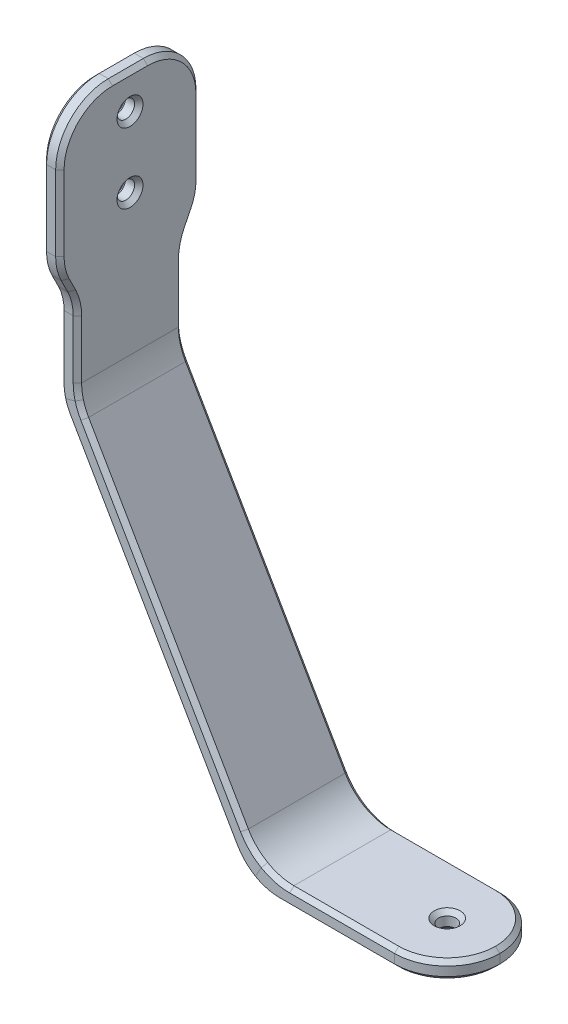
from build123d import *

# Parameters (mm, degrees)
SKETCH2_W               = 3.175
SKETCH2_H               = 19.05
BOSS_EXTRUDE1_DEPTH     = 1.5875
CUT_EXTRUDE1_DEPTH      = 128.966941084
CUT_EXTRUDE1_DEPTH_BACK = 128.966941084
SKETCH8_R               = 1.5875
CUT_EXTRUDE2_DEPTH      = 126.316205076
CUT_EXTRUDE2_DEPTH_BACK = 126.316205076
SKETCH9_R               = 1.5875
FILLET1_R               = 9.525
CHAMFER1_SIZE           = 0.762


with BuildPart() as part:
    # Sweep1: sweep along a path in Sketch1
    with BuildLine(Plane.XY) as sweep1_path:
        Line((0, 0), (0, -47.5145354))
        Line((0, -47.5145354), (33.61082832, -105.730197734))
        Line((33.61082832, -105.730197734), (68.53582832, -105.730197734))
    # Sketch2 → Sweep1 (sweep)
    with BuildSketch(Plane(origin=(0, 0, 0), x_dir=(1, 0, 0), z_dir=(0, 1, 0))):
        Rectangle(SKETCH2_W, SKETCH2_H)
    sweep(path=sweep1_path.line, transition=Transition.RIGHT)

    # Sketch7 → Boss-Extrude1 (add, symmetric)
    with BuildSketch(Plane(origin=(0, 0, 0), x_dir=(0, 0, -1), z_dir=(1, 0, 0))):
        Polygon((-12.7, -25.4), (-9.525, -31.75), (9.525, -31.75), (12.7, -25.4), (12.7, 0), (-12.7, 0), align=None)
    extrude(amount=BOSS_EXTRUDE1_DEPTH, both=True)

    # Sketch8 → Cut-Extrude1 (cut, two sides: drawn at the far end of the back side and taken through both)
    with BuildSketch(Plane(origin=(0, 0, 0), x_dir=(0, 0, -1), z_dir=(1, 0, 0)).offset(-CUT_EXTRUDE1_DEPTH_BACK)):
        with Locations((0, -6.35)):
            Circle(SKETCH8_R)
        with Locations((0, -19.05)):
            Circle(SKETCH8_R)
    extrude(amount=CUT_EXTRUDE1_DEPTH + CUT_EXTRUDE1_DEPTH_BACK, mode=Mode.SUBTRACT)

    # Sketch9 → Cut-Extrude2 (cut, two sides: drawn at the far end of the back side and taken through both)
    with BuildSketch(Plane(origin=(0, -104.142697734, 0), x_dir=(1, 0, 0), z_dir=(0, 1, 0)).offset(-CUT_EXTRUDE2_DEPTH_BACK)):
        with Locations(Location((59.01082832, 0, 0), (0, 0, 180))):
            Circle(SKETCH9_R)
    extrude(amount=CUT_EXTRUDE2_DEPTH + CUT_EXTRUDE2_DEPTH_BACK, mode=Mode.SUBTRACT)

    # Fillet1
    fillet1_edges = [part.edges().sort_by_distance(p)[0] for p in [
        (0, -31.75, -9.525),
        (0, -25.4, -12.7),
        (0, -31.75, 9.525),
        (0, -25.4, 12.7),
        (0, 0, -12.7),
        (0, 0, 12.7),
        (68.53582832, -105.730197734, -9.525),
        (68.53582832, -105.730197734, 9.525),
        (1.5875, -47.089166057, 0),
        (-1.5875, -47.939904743, 0),
        (32.694284767, -107.317697734, 0),
        (34.527371872, -104.142697734, 0),
    ]]
    fillet(fillet1_edges, radius=FILLET1_R - 0.0001)  # a hair under: the kernel refuses the full size

    # Chamfer1
    chamfer1_edges = [part.edges().sort_by_distance(p)[0] for p in [
        (14.816638805, -76.352706607, 9.525),
        (14.816638805, -76.352706607, -9.525),
        (33.431038346, -106.041603103, -9.525),
        (-1.262946903, -47.852941003, -9.525),
        (-1.5875, -39.693119679, -9.525),
        (-1.262946903, -47.852941003, -9.525),
        (-1.5875, 0, 0),
        (-1.5875, -16.338188061, -12.7),
        (-1.5875, -28.575, -11.1125),
        (-1.5875, -39.693119679, 9.525),
        (-1.5875, -28.575, 11.1125),
        (-1.5875, -16.338188061, 12.7),
        (-1.5875, -2.78977862, 9.91022138),
        (-1.5875, -2.78977862, -9.91022138),
        (-1.5875, -25.339849714, 12.4451993),
        (-1.5875, -25.339849714, -12.4451993),
        (-1.262946903, -47.852941003, 9.525),
        (33.431038346, -106.041603103, 9.525),
        (-1.262946903, -47.852941003, 9.525),
        (48.602208333, -107.317697734, -9.525),
        (48.602208333, -107.317697734, 9.525),
        (65.7460497, -107.317697734, 6.73522138),
        (65.7460497, -107.317697734, -6.73522138),
        (49.518751885, -104.142697734, -9.525),
        (33.431038346, -106.041603103, -9.525),
        (49.518751885, -104.142697734, 9.525),
        (33.431038346, -106.041603103, 9.525),
        (65.7460497, -104.142697734, 6.73522138),
        (65.7460497, -104.142697734, -6.73522138),
        (1.912053097, -47.002202317, 9.525),
        (1.912053097, -47.002202317, 9.525),
        (1.912053097, -47.002202317, -9.525),
        (1.912053097, -47.002202317, -9.525),
        (35.264125451, -102.866603103, 9.525),
        (35.264125451, -102.866603103, 9.525),
        (35.264125451, -102.866603103, -9.525),
        (35.264125451, -102.866603103, -9.525),
        (-1.5875, -31.810150286, -9.7798007),
        (1.5875, -31.810150286, -9.7798007),
        (-1.5875, -31.810150286, 9.7798007),
        (1.5875, -31.810150286, 9.7798007),
        (-1.5875, -6.35, 1.5875),
        (1.5875, -6.35, 1.5875),
        (-1.5875, -19.05, 1.5875),
        (1.5875, -19.05, 1.5875),
        (60.59832832, -107.317697734, 0),
        (60.59832832, -104.142697734, 0),
        (17.320682357, -74.339837264, -9.525),
        (17.320682357, -74.339837264, 9.525),
        (1.5875, 0, 0),
        (1.5875, -16.338188061, 12.7),
        (1.5875, -28.575, 11.1125),
        (1.5875, -39.267750336, 9.525),
        (1.5875, -39.267750336, -9.525),
        (1.5875, -28.575, -11.1125),
        (1.5875, -16.338188061, -12.7),
        (1.5875, -2.78977862, 9.91022138),
        (1.5875, -2.78977862, -9.91022138),
        (1.5875, -25.339849714, 12.4451993),
        (1.5875, -25.339849714, -12.4451993),
    ]]
    chamfer(chamfer1_edges, length=CHAMFER1_SIZE)


solid = part.part
